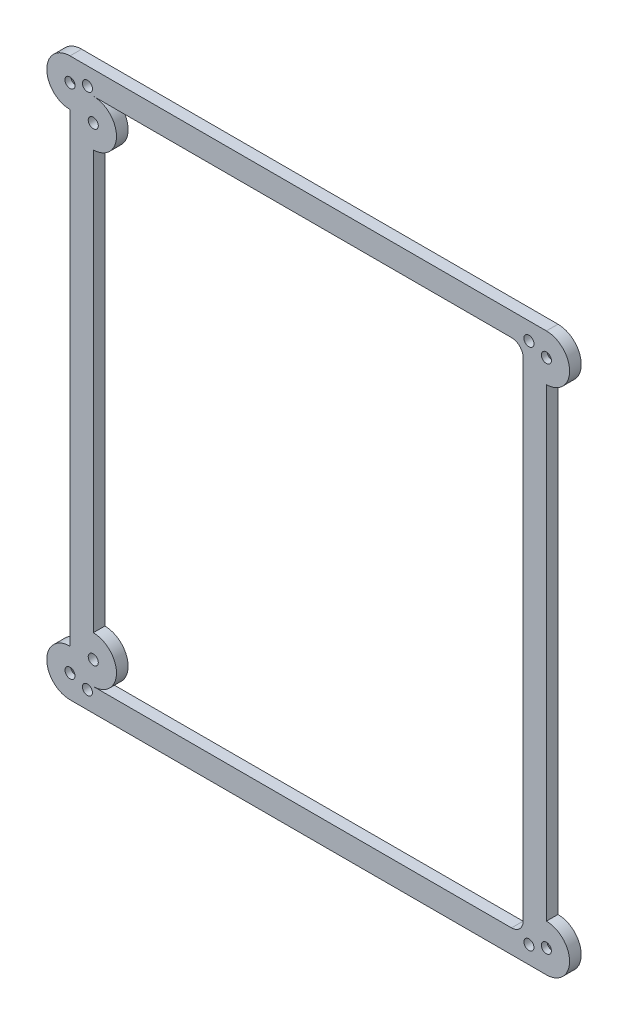
from build123d import *

# Parameters (mm, degrees)
SKETCH1_R           = 2.75
BOSS_EXTRUDE1_DEPTH = 6.35
FILLET1_R           = 6.35
CHAMFER1_SIZE       = 3.175


with BuildPart() as part:
    # Sketch1 → Boss-Extrude1 (new body)
    with BuildSketch(Plane.XY):
        with BuildLine():
            Line((241.3, 19.05), (-19.05, 19.05))
            ThreePointArc((-19.05, 19.05), (-31.75, 6.35), (-19.05, -6.35))
            Line((-19.05, -6.35), (-19.05, -260.35))
            ThreePointArc((-19.05, -260.35), (-31.75, -273.05), (-19.05, -285.75))
            Line((-19.05, -285.75), (241.3, -285.75))
            ThreePointArc((241.3, -285.75), (254, -273.05), (241.3, -260.35))
            Line((241.3, -260.35), (241.3, -6.35))
            ThreePointArc((241.3, -6.35), (254, 6.35), (241.3, 19.05))
        make_face()
        with Locations((-19.05, -273.05)):
            Circle(SKETCH1_R, mode=Mode.SUBTRACT)
        with BuildLine():
            Line((228.6, -273.05), (-6.35, -273.05))
            ThreePointArc((-6.35, -273.05), (6.35, -260.35), (-6.35, -247.65))
            Line((-6.35, -247.65), (-6.35, -19.05))
            ThreePointArc((-6.35, -19.05), (6.35, -6.35), (-6.35, 6.35))
            Line((-6.35, 6.35), (228.6, 6.35))
            Line((228.6, 6.35), (228.6, -273.05))
        make_face(mode=Mode.SUBTRACT)
        with Locations((-19.05, 6.35)):
            Circle(SKETCH1_R, mode=Mode.SUBTRACT)
        with Locations((241.3, 6.35)):
            Circle(SKETCH1_R, mode=Mode.SUBTRACT)
        with Locations((241.3, -273.05)):
            Circle(SKETCH1_R, mode=Mode.SUBTRACT)
        with Locations((-9.525, -276.225)):
            Circle(SKETCH1_R, mode=Mode.SUBTRACT)
        with Locations((231.775, -276.225)):
            Circle(SKETCH1_R, mode=Mode.SUBTRACT)
        with Locations((-9.525, 9.525)):
            Circle(SKETCH1_R, mode=Mode.SUBTRACT)
        with Locations((231.775, 9.525)):
            Circle(SKETCH1_R, mode=Mode.SUBTRACT)
        with Locations((-6.35, -260.35)):
            Circle(SKETCH1_R, mode=Mode.SUBTRACT)
        with Locations((-6.35, -6.35)):
            Circle(SKETCH1_R, mode=Mode.SUBTRACT)
    extrude(amount=BOSS_EXTRUDE1_DEPTH)

    # Fillet1
    fillet1_edges = [part.edges().sort_by_distance(p)[0] for p in [
        (228.6, 6.35, 3.175),
        (228.6, -273.05, 3.175),
    ]]
    fillet(fillet1_edges, radius=FILLET1_R)

    # Chamfer1
    chamfer1_edges = [part.edges().sort_by_distance(p)[0] for p in [
        (-21.8, 6.35, 0),
        (238.55, 6.35, 0),
        (238.55, -273.05, 0),
        (-21.8, -273.05, 0),
    ]]
    chamfer(chamfer1_edges, length=CHAMFER1_SIZE)


solid = part.part
